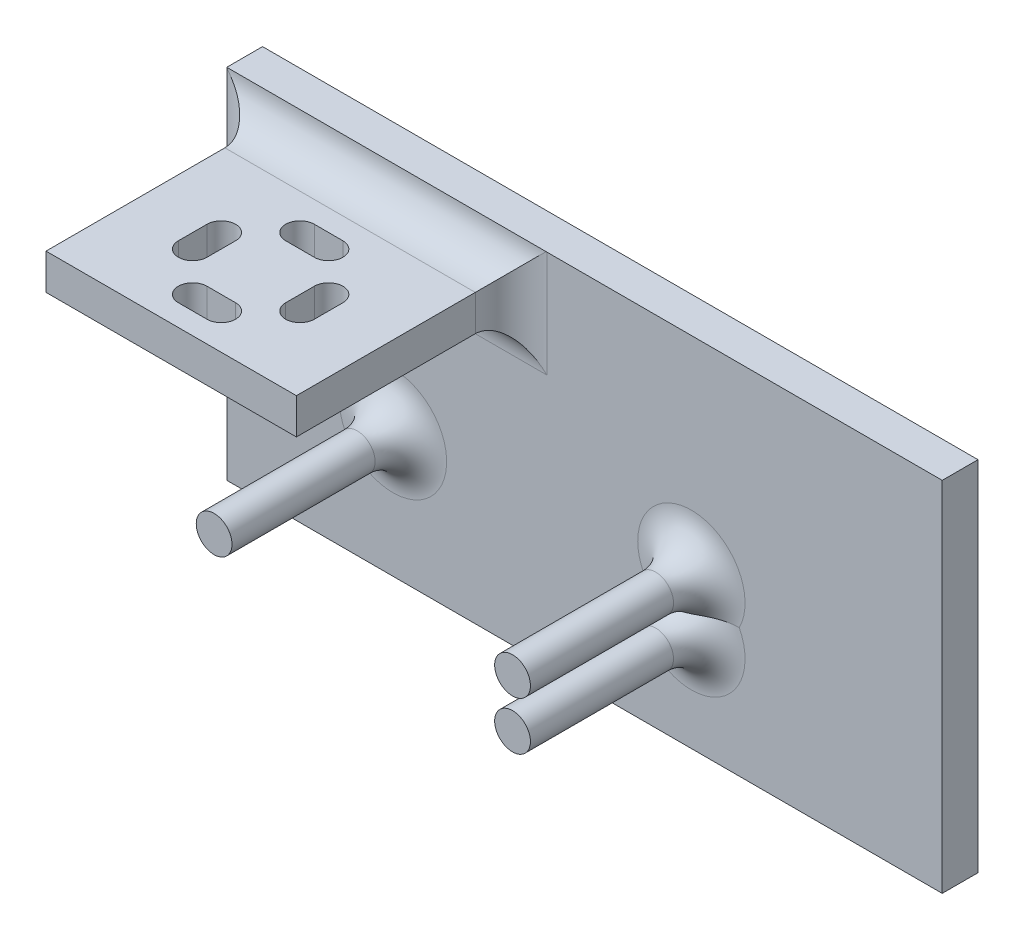
from build123d import *

# Parameters (mm, degrees)
SKETCH1_W                 = 50.8
SKETCH1_H                 = 25.4
BASE_DEPTH                = 2.54
SKETCH2_R                 = 1.27
GUIDEPOSTS_DEPTH          = 12.7
SKETCH3_W                 = 17.78
SKETCH3_H                 = 2.54
BUTTON_HOLDER_DEPTH       = 15.24
ROUND_ON_BUTTON_HOLDER_R  = 2.54
ONE_BUTTON_LEG_HOLE_REACH = 40.556
BUTTON_LEG_HOLES_COUNT    = 4


with BuildPart() as part:
    # Sketch1 → base (new body)
    with BuildSketch(Plane.XY):
        Rectangle(SKETCH1_W, SKETCH1_H)
    extrude(amount=BASE_DEPTH)

    # Sketch2 → guideposts (add)
    with BuildSketch(Plane.XY.offset(2.54)):
        with Locations(Location((7.590347968, -1.846813132, 0), (0, 0, 180))):
            Circle(SKETCH2_R)
        with Locations(Location((7.590347968, -5.285256746, 0), (0, 0, 180))):
            Circle(SKETCH2_R)
        with Locations(Location((-13.597624432, -3.751813132, 0), (0, 0, 180))):
            Circle(SKETCH2_R)
    extrude(amount=GUIDEPOSTS_DEPTH)

    # Sketch3 → button holder (add)
    with BuildSketch(Plane.XY.offset(2.54)):
        with Locations((-14.105624432, 8.948186868)):
            Rectangle(SKETCH3_W, SKETCH3_H)
    extrude(amount=BUTTON_HOLDER_DEPTH)

    # round on button holder
    # the kernel refuses this fillet: 2.54 mm, written as the material it adds along each edge
    with BuildSketch(Plane(origin=(7.590347968, -1.846813132, 2.54), x_dir=(-1, 0, 0), z_dir=(0, 1, 0))) as round_on_button_holder_piece_1:
        with BuildLine():
            CenterArc((1.27 + ROUND_ON_BUTTON_HOLDER_R, ROUND_ON_BUTTON_HOLDER_R), ROUND_ON_BUTTON_HOLDER_R, 180, 90)
            Line((1.27, ROUND_ON_BUTTON_HOLDER_R), (1.27, 0))
            Line((1.27, 0), (1.27 + ROUND_ON_BUTTON_HOLDER_R, 0))
        make_face()
    round_on_button_holder_piece_1_solid = revolve(axis=Axis((7.590347968, -1.846813132, 2.54), (0, 0, 1)), mode=Mode.PRIVATE)
    with BuildSketch(Plane(origin=(7.590347968, -5.285256746, 2.54), x_dir=(-1, 0, 0), z_dir=(0, 1, 0))) as round_on_button_holder_piece_2:
        with BuildLine():
            CenterArc((1.27 + ROUND_ON_BUTTON_HOLDER_R, ROUND_ON_BUTTON_HOLDER_R), ROUND_ON_BUTTON_HOLDER_R, 180, 90)
            Line((1.27, ROUND_ON_BUTTON_HOLDER_R), (1.27, 0))
            Line((1.27, 0), (1.27 + ROUND_ON_BUTTON_HOLDER_R, 0))
        make_face()
    round_on_button_holder_piece_2_solid = revolve(axis=Axis((7.590347968, -5.285256746, 2.54), (0, 0, 1)), mode=Mode.PRIVATE)
    with BuildSketch(Plane(origin=(-13.597624432, -3.751813132, 2.54), x_dir=(-1, 0, 0), z_dir=(0, 1, 0))) as round_on_button_holder_piece_3:
        with BuildLine():
            CenterArc((1.27 + ROUND_ON_BUTTON_HOLDER_R, ROUND_ON_BUTTON_HOLDER_R), ROUND_ON_BUTTON_HOLDER_R, 180, 90)
            Line((1.27, ROUND_ON_BUTTON_HOLDER_R), (1.27, 0))
            Line((1.27, 0), (1.27 + ROUND_ON_BUTTON_HOLDER_R, 0))
        make_face()
    round_on_button_holder_piece_3_solid = revolve(axis=Axis((-13.597624432, -3.751813132, 2.54), (0, 0, 1)), mode=Mode.PRIVATE)
    with BuildSketch(Plane(origin=(-5.215624432, 7.678186868, 2.54), x_dir=(1, 0, 0), z_dir=(0, 1, 0))) as round_on_button_holder_piece_4:
        with BuildLine():
            CenterArc((ROUND_ON_BUTTON_HOLDER_R, -ROUND_ON_BUTTON_HOLDER_R), ROUND_ON_BUTTON_HOLDER_R, 90, 90)
            Line((0, -ROUND_ON_BUTTON_HOLDER_R), (0, 0))
            Line((0, 0), (ROUND_ON_BUTTON_HOLDER_R, 0))
        make_face()
    round_on_button_holder_piece_4_solid = extrude(amount=2.54, mode=Mode.PRIVATE)
    with BuildSketch(Plane(origin=(-5.215624432, 10.218186868, 2.54), x_dir=(0, 1, 0), z_dir=(-1, 0, 0))) as round_on_button_holder_piece_5_section:
        with BuildLine():
            CenterArc((ROUND_ON_BUTTON_HOLDER_R, -ROUND_ON_BUTTON_HOLDER_R), ROUND_ON_BUTTON_HOLDER_R, 90, 90)
            Line((0, -ROUND_ON_BUTTON_HOLDER_R), (0, 0))
            Line((0, 0), (ROUND_ON_BUTTON_HOLDER_R, 0))
        make_face()
    round_on_button_holder_piece_5 = extrude(amount=17.78, mode=Mode.PRIVATE)
    round_on_button_holder_piece_5 = split(round_on_button_holder_piece_5, bisect_by=Plane(origin=(-5.215624432, 12.7, 2.54), z_dir=(0, -1, 0)), keep=Keep.TOP, mode=Mode.PRIVATE)
    with BuildSketch(Plane(origin=(-22.995624432, 10.218186868, 2.54), x_dir=(-1, 0, 0), z_dir=(0, -1, 0))) as round_on_button_holder_piece_6:
        with BuildLine():
            CenterArc((2.54, -2.536376552), ROUND_ON_BUTTON_HOLDER_R, 93.060789284, 86.939210716)
            Line((0, -2.536376552), (0, 0))
            Line((0, 0), (2.404375568, 0))
        make_face()
    round_on_button_holder_piece_6_solid = extrude(amount=2.54, mode=Mode.PRIVATE)
    with BuildSketch(Plane(origin=(-22.995624432, 7.678186868, 2.54), x_dir=(0, -1, 0), z_dir=(1, 0, 0))) as round_on_button_holder_piece_7:
        with BuildLine():
            CenterArc((ROUND_ON_BUTTON_HOLDER_R, -ROUND_ON_BUTTON_HOLDER_R), ROUND_ON_BUTTON_HOLDER_R, 90, 90)
            Line((0, -ROUND_ON_BUTTON_HOLDER_R), (0, 0))
            Line((0, 0), (ROUND_ON_BUTTON_HOLDER_R, 0))
        make_face()
    round_on_button_holder_piece_7_solid = extrude(amount=17.78, mode=Mode.PRIVATE)
    with BuildSketch(Plane(origin=(-22.995624432, 7.678186868, 2.54), x_dir=(0, -1, 0), z_dir=(1, 0, 0))) as round_on_button_holder_piece_8a_section:
        with BuildLine():
            CenterArc((ROUND_ON_BUTTON_HOLDER_R, -ROUND_ON_BUTTON_HOLDER_R), ROUND_ON_BUTTON_HOLDER_R, 90, 90)
            Line((0, -ROUND_ON_BUTTON_HOLDER_R), (0, 0))
            Line((0, 0), (ROUND_ON_BUTTON_HOLDER_R, 0))
        make_face()
    round_on_button_holder_piece_8a = extrude(amount=24.13, mode=Mode.PRIVATE)
    round_on_button_holder_piece_8a = split(round_on_button_holder_piece_8a, bisect_by=Plane(origin=(-5.215624432, 7.678186868, 2.54), z_dir=(1, 0, 0)), keep=Keep.TOP, mode=Mode.PRIVATE)
    with BuildSketch(Plane(origin=(-5.215624432, 1.328186868, 2.54), x_dir=(1, 0, 0), z_dir=(0, 1, 0))) as round_on_button_holder_piece_8b_section:
        with BuildLine():
            CenterArc((ROUND_ON_BUTTON_HOLDER_R, -ROUND_ON_BUTTON_HOLDER_R), ROUND_ON_BUTTON_HOLDER_R, 90, 90)
            Line((0, -ROUND_ON_BUTTON_HOLDER_R), (0, 0))
            Line((0, 0), (ROUND_ON_BUTTON_HOLDER_R, 0))
        make_face()
    round_on_button_holder_piece_8b = extrude(amount=8.89, mode=Mode.PRIVATE)
    round_on_button_holder_piece_8b = split(round_on_button_holder_piece_8b, bisect_by=Plane(origin=(-5.215624432, 7.678186868, 2.54), z_dir=(0, -1, 0)), keep=Keep.TOP, mode=Mode.PRIVATE)
    round_on_button_holder_piece_8 = round_on_button_holder_piece_8a & round_on_button_holder_piece_8b
    with BuildSketch(Plane(origin=(-5.215624432, 7.678186868, 2.54), x_dir=(1, 0, 0), z_dir=(0, 1, 0))) as round_on_button_holder_piece_9a_section:
        with BuildLine():
            CenterArc((ROUND_ON_BUTTON_HOLDER_R, -ROUND_ON_BUTTON_HOLDER_R), ROUND_ON_BUTTON_HOLDER_R, 90, 90)
            Line((0, -ROUND_ON_BUTTON_HOLDER_R), (0, 0))
            Line((0, 0), (ROUND_ON_BUTTON_HOLDER_R, 0))
        make_face()
    round_on_button_holder_piece_9a = extrude(amount=8.89, mode=Mode.PRIVATE)
    round_on_button_holder_piece_9a = split(round_on_button_holder_piece_9a, bisect_by=Plane(origin=(-5.215624432, 12.7, 2.54), z_dir=(0, -1, 0)), keep=Keep.TOP, mode=Mode.PRIVATE)
    round_on_button_holder_piece_9a = split(round_on_button_holder_piece_9a, bisect_by=Plane(origin=(-5.215624432, 10.218186868, 2.54), z_dir=(0, 1, 0)), keep=Keep.TOP, mode=Mode.PRIVATE)
    with BuildSketch(Plane(origin=(1.134375568, 10.218186868, 2.54), x_dir=(0, 1, 0), z_dir=(-1, 0, 0))) as round_on_button_holder_piece_9b_section:
        with BuildLine():
            CenterArc((ROUND_ON_BUTTON_HOLDER_R, -ROUND_ON_BUTTON_HOLDER_R), ROUND_ON_BUTTON_HOLDER_R, 90, 90)
            Line((0, -ROUND_ON_BUTTON_HOLDER_R), (0, 0))
            Line((0, 0), (ROUND_ON_BUTTON_HOLDER_R, 0))
        make_face()
    round_on_button_holder_piece_9b = extrude(amount=24.13, mode=Mode.PRIVATE)
    round_on_button_holder_piece_9b = split(round_on_button_holder_piece_9b, bisect_by=Plane(origin=(-5.215624432, 10.218186868, 2.54), z_dir=(1, 0, 0)), keep=Keep.TOP, mode=Mode.PRIVATE)
    round_on_button_holder_piece_9 = round_on_button_holder_piece_9a & round_on_button_holder_piece_9b
    with BuildSketch(Plane(origin=(-5.215624432, 10.218186868, 2.54), x_dir=(0, 1, 0), z_dir=(-1, 0, 0))) as round_on_button_holder_piece_10a_section:
        with BuildLine():
            CenterArc((ROUND_ON_BUTTON_HOLDER_R, -ROUND_ON_BUTTON_HOLDER_R), ROUND_ON_BUTTON_HOLDER_R, 90, 90)
            Line((0, -ROUND_ON_BUTTON_HOLDER_R), (0, 0))
            Line((0, 0), (ROUND_ON_BUTTON_HOLDER_R, 0))
        make_face()
    round_on_button_holder_piece_10a = extrude(amount=24.13, mode=Mode.PRIVATE)
    round_on_button_holder_piece_10a = split(round_on_button_holder_piece_10a, bisect_by=Plane(origin=(-25.4, 10.218186868, 2.54), z_dir=(1, 0, 0)), keep=Keep.TOP, mode=Mode.PRIVATE)
    round_on_button_holder_piece_10a = split(round_on_button_holder_piece_10a, bisect_by=Plane(origin=(-22.995624432, 10.218186868, 2.54), z_dir=(-1, 0, 0)), keep=Keep.TOP, mode=Mode.PRIVATE)
    with BuildSketch(Plane(origin=(-22.995624432, 16.559128248, 2.54), x_dir=(-1, 0, 0), z_dir=(0, -1, 0))) as round_on_button_holder_piece_10b_section:
        with BuildLine():
            CenterArc((2.54, -2.536376552), ROUND_ON_BUTTON_HOLDER_R, 93.060789284, 86.939210716)
            Line((0, -2.536376552), (0, 0))
            Line((0, 0), (2.404375568, 0))
        make_face()
    round_on_button_holder_piece_10b = extrude(amount=8.88094138, mode=Mode.PRIVATE)
    round_on_button_holder_piece_10b = split(round_on_button_holder_piece_10b, bisect_by=Plane(origin=(-22.995624432, 12.7, 2.54), z_dir=(0, -1, 0)), keep=Keep.TOP, mode=Mode.PRIVATE)
    round_on_button_holder_piece_10b = split(round_on_button_holder_piece_10b, bisect_by=Plane(origin=(-22.995624432, 10.218186868, 2.54), z_dir=(0, 1, 0)), keep=Keep.TOP, mode=Mode.PRIVATE)
    round_on_button_holder_piece_10 = round_on_button_holder_piece_10a & round_on_button_holder_piece_10b
    with BuildSketch(Plane(origin=(-29.345624432, 7.678186868, 2.54), x_dir=(0, -1, 0), z_dir=(1, 0, 0))) as round_on_button_holder_piece_11a_section:
        with BuildLine():
            CenterArc((ROUND_ON_BUTTON_HOLDER_R, -ROUND_ON_BUTTON_HOLDER_R), ROUND_ON_BUTTON_HOLDER_R, 90, 90)
            Line((0, -ROUND_ON_BUTTON_HOLDER_R), (0, 0))
            Line((0, 0), (ROUND_ON_BUTTON_HOLDER_R, 0))
        make_face()
    round_on_button_holder_piece_11a = extrude(amount=24.13, mode=Mode.PRIVATE)
    round_on_button_holder_piece_11a = split(round_on_button_holder_piece_11a, bisect_by=Plane(origin=(-25.4, 7.678186868, 2.54), z_dir=(1, 0, 0)), keep=Keep.TOP, mode=Mode.PRIVATE)
    round_on_button_holder_piece_11a = split(round_on_button_holder_piece_11a, bisect_by=Plane(origin=(-22.995624432, 7.678186868, 2.54), z_dir=(-1, 0, 0)), keep=Keep.TOP, mode=Mode.PRIVATE)
    with BuildSketch(Plane(origin=(-22.995624432, 10.218186868, 2.54), x_dir=(-1, 0, 0), z_dir=(0, -1, 0))) as round_on_button_holder_piece_11b_section:
        with BuildLine():
            CenterArc((2.54, -2.536376552), ROUND_ON_BUTTON_HOLDER_R, 93.060789284, 86.939210716)
            Line((0, -2.536376552), (0, 0))
            Line((0, 0), (2.404375568, 0))
        make_face()
    round_on_button_holder_piece_11b = extrude(amount=8.88094138, mode=Mode.PRIVATE)
    round_on_button_holder_piece_11b = split(round_on_button_holder_piece_11b, bisect_by=Plane(origin=(-22.995624432, 7.678186868, 2.54), z_dir=(0, -1, 0)), keep=Keep.TOP, mode=Mode.PRIVATE)
    round_on_button_holder_piece_11 = round_on_button_holder_piece_11a & round_on_button_holder_piece_11b
    add([round_on_button_holder_piece_1_solid, round_on_button_holder_piece_2_solid, round_on_button_holder_piece_3_solid, round_on_button_holder_piece_4_solid, round_on_button_holder_piece_5, round_on_button_holder_piece_6_solid, round_on_button_holder_piece_7_solid, round_on_button_holder_piece_8, round_on_button_holder_piece_9, round_on_button_holder_piece_10, round_on_button_holder_piece_11])

    # Sketch4 → one button leg hole (cut, up to next)
    with BuildSketch(Plane(origin=(0, 10.218186868, 0), x_dir=(1, 0, 0), z_dir=(0, 1, 0)), mode=Mode.PRIVATE) as one_button_leg_hole_sk1:
        with BuildLine():
            Line((-15.121624432, -14.224), (-13.089624432, -14.224))
            ThreePointArc((-13.089624432, -14.224), (-12.073624432, -15.24), (-13.089624432, -16.256))
            Line((-13.089624432, -16.256), (-15.121624432, -16.256))
            ThreePointArc((-15.121624432, -16.256), (-16.137624432, -15.24), (-15.121624432, -14.224))
        make_face()
    one_button_leg_hole_tool1 = extrude(one_button_leg_hole_sk1.sketch, amount=-ONE_BUTTON_LEG_HOLE_REACH, mode=Mode.PRIVATE) & part.part
    one_button_leg_hole = one_button_leg_hole_tool1.solids().sort_by_distance((-14.105624, 10.218187, 15.24))[0]
    add(one_button_leg_hole, mode=Mode.SUBTRACT)

    # button leg holes: one button leg hole ×4 about axis
    button_leg_holes_axis = Axis((-14.105624476, 0, 11.429666717), (0, 1, 0))
    for i in range(1, BUTTON_LEG_HOLES_COUNT):
        add(one_button_leg_hole.rotate(button_leg_holes_axis, i * 360 / BUTTON_LEG_HOLES_COUNT), mode=Mode.SUBTRACT)


solid = part.part
